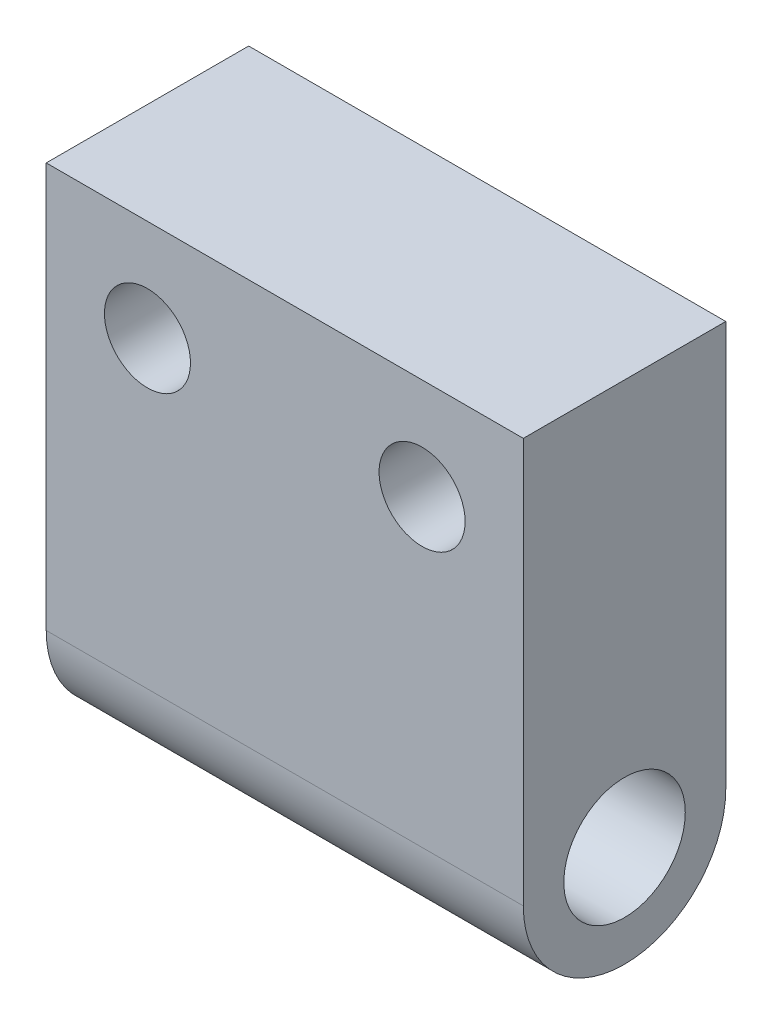
from build123d import *

# Parameters (mm, degrees)
SKETCH1_W                      = 47.129705535
SKETCH1_H                      = 50
EXTRUDE1_DEPTH                 = 20
F_8_5_8_5_DIAMETER_HOLE1_D     = 8.5
F_8_5_8_5_DIAMETER_HOLE1_DEPTH = 47.13
F_8_5_8_5_DIAMETER_HOLE1_TIP   = 2.553657631
SKETCH4_R                      = 6
EXTRUDE2_DEPTH                 = 10
EXTRUDE3_START                 = -10
SKETCH3_R                      = 6
EXTRUDE3_DEPTH                 = 10
F_8_5_8_5_DIAMETER_HOLE2_D     = 8.5
FILLET1_R                      = 10


with BuildPart() as part:
    # Sketch1 → Extrude1 (new body)
    with BuildSketch(Plane.XY):
        with Locations((23.564852768, 25)):
            Rectangle(SKETCH1_W, SKETCH1_H)
    extrude(amount=EXTRUDE1_DEPTH)

    # Ø8.5 (8.5) Diameter Hole1
    with Locations(Plane(origin=(47.129705535, 10, 10), x_dir=(0, 0, 1), z_dir=(1, 0, 0))):
        with Locations((0, 0)):
            Hole(F_8_5_8_5_DIAMETER_HOLE1_D / 2, depth=F_8_5_8_5_DIAMETER_HOLE1_DEPTH)
            with Locations((0, 0, -(F_8_5_8_5_DIAMETER_HOLE1_DEPTH + F_8_5_8_5_DIAMETER_HOLE1_TIP / 2))):  # 118° drill point
                Cone(0, F_8_5_8_5_DIAMETER_HOLE1_D / 2, F_8_5_8_5_DIAMETER_HOLE1_TIP, mode=Mode.SUBTRACT)

    # Sketch4 → Extrude2 (cut)
    with BuildSketch(Plane.ZY):
        with Locations((10, 10)):
            Circle(SKETCH4_R)
    extrude(amount=-EXTRUDE2_DEPTH, mode=Mode.SUBTRACT)

    # Sketch3 → Extrude3 (cut)
    with BuildSketch(Plane(origin=(47.129705535, 0, 0), x_dir=(0, 0, -1), z_dir=(1, 0, 0)).offset(EXTRUDE3_START)):
        with Locations(Location((-10, 10, 0), (0, 0, 180))):
            Circle(SKETCH3_R)
    extrude(amount=EXTRUDE3_DEPTH, mode=Mode.SUBTRACT)

    # Ø8.5 (8.5) Diameter Hole2 (through all)
    with Locations(Plane(origin=(37.129705535, 40, 20), x_dir=(1, 0, 0), z_dir=(0, 0, 1))):
        with Locations((0, 0), (-27.129705535, 0)):
            Hole(F_8_5_8_5_DIAMETER_HOLE2_D / 2)

    # Fillet1
    fillet1_edges = [part.edges().sort_by_distance(p)[0] for p in [
        (23.564852768, 0, 20),
        (23.564852768, 0, 0),
    ]]
    fillet(fillet1_edges, radius=FILLET1_R - 0.0001)  # a hair under: the kernel refuses the full size


solid = part.part
